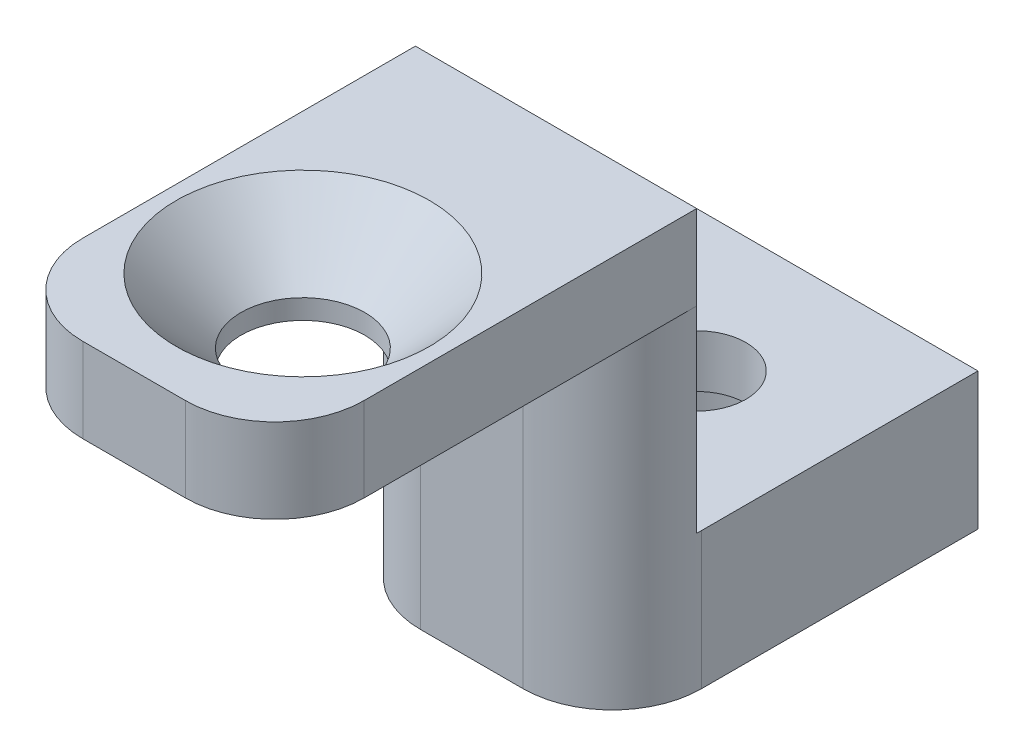
from build123d import *

# Parameters (mm, degrees)
BOSS_EXTRUDE1_DEPTH = 5
FILLET2_R           = 3.175


with BuildPart() as part:
    # Sketch1 → Boss-Extrude1 (new, symmetric)
    with BuildSketch(Plane(origin=(0, 0, 0), x_dir=(0, 0, -1), z_dir=(1, 0, 0))):
        Polygon((-12, 0), (0, 0), (0, -11.87), (13, -11.87), (13, -7), (3, -7), (3, 3), (-12, 3), align=None)
    extrude(amount=BOSS_EXTRUDE1_DEPTH, both=True)

    # Sketch4 → Cut-Revolve1 (revolve, cut)
    with BuildSketch(Plane(origin=(0, 0, 0), x_dir=(0, 0, -1), z_dir=(1, 0, 0)), mode=Mode.PRIVATE) as cut_revolve1_sk:
        Polygon((-6, 3), (-10.5, 3), (-8.2, 0.7), (-8.2, 0), (-6, 0), align=None)
    revolve(cut_revolve1_sk.sketch.rotate(Axis((0, 0, 6), (0, 1, 0)), 180), axis=Axis((0, 0, 6), (0, 1, 0)), mode=Mode.SUBTRACT)

    # Sketch5 → Cut-Revolve2 (revolve, cut)
    with BuildSketch(Plane(origin=(0, 0, 0), x_dir=(0, 0, -1), z_dir=(1, 0, 0))):
        Polygon((8, -11.87), (8, -7), (9.75, -7), (9.75, -8.87), (11.2, -8.87), (11.2, -11.87), align=None)
    revolve(axis=Axis((0, -11.87, -8), (0, 1, 0)), mode=Mode.SUBTRACT)

    # Fillet2
    # the kernel refuses this fillet: 3.175 mm, written as the material it takes off along each edge
    with BuildSketch(Plane(origin=(-5, 0, 0), x_dir=(0, 0, -1), z_dir=(0, -1, 0)), Plane(origin=(5, 0, 0), x_dir=(-1, 0, 0), z_dir=(0, -1, 0))) as fillet2_piece_1:
        with BuildLine():
            CenterArc((FILLET2_R, FILLET2_R), FILLET2_R, 180, 90)
            Line((0, FILLET2_R), (0, 0))
            Line((0, 0), (FILLET2_R, 0))
        make_face()
    extrude(amount=19.8075, mode=Mode.SUBTRACT)
    with BuildSketch(Plane(origin=(-5, 10.9375, 12), x_dir=(0, 0, -1), z_dir=(0, -1, 0)), Plane(origin=(5, 10.9375, 12), x_dir=(-1, 0, 0), z_dir=(0, -1, 0))) as fillet2_piece_2:
        with BuildLine():
            CenterArc((FILLET2_R, FILLET2_R), FILLET2_R, 180, 90)
            Line((0, FILLET2_R), (0, 0))
            Line((0, 0), (FILLET2_R, 0))
        make_face()
    extrude(amount=18.875, mode=Mode.SUBTRACT)


solid = part.part
